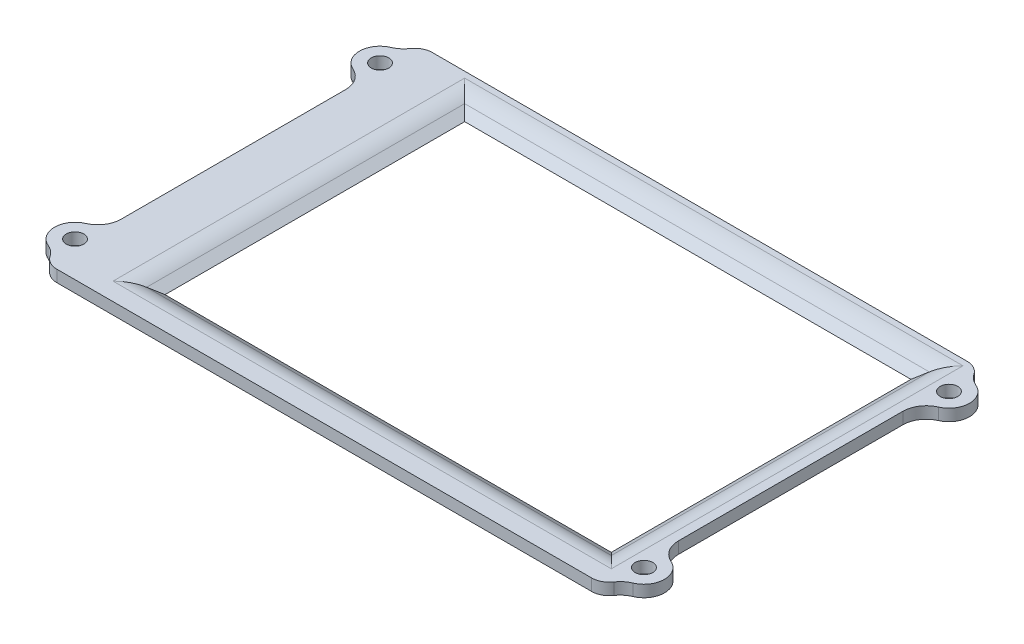
from build123d import *

# Parameters (mm, degrees)
SKETCH1_W           = 95
SKETCH1_H           = 64
BOSS_EXTRUDE1_DEPTH = 2
SKETCH2_R           = 3.5
BOSS_EXTRUDE2_DEPTH = 2
FILLET1_R           = 4
FILLET2_R           = 3
SKETCH3_R           = 1.5
CUT_EXTRUDE1_DEPTH  = 62.090097397
SKETCH4_W           = 75.8
SKETCH4_H           = 50.8
CUT_EXTRUDE2_DEPTH  = 62.090097397
CHAMFER1_SIZE       = 3
CHAMFER1_SIZE_2     = 2.100622615
FILLET3_R           = 5


with BuildPart() as part:
    # Sketch1 → Boss-Extrude1 (new body)
    with BuildSketch(Plane(origin=(0, 0, 0), x_dir=(1, 0, 0), z_dir=(0, 1, 0))):
        Rectangle(SKETCH1_W, SKETCH1_H)
    extrude(amount=BOSS_EXTRUDE1_DEPTH)

    # Sketch2 → Boss-Extrude2 (add)
    with BuildSketch(Plane(origin=(0, 2, 0), x_dir=(1, 0, 0), z_dir=(0, 1, 0))):
        with Locations((-48.5, -26)):
            Circle(SKETCH2_R)
        with Locations((-48.5, 26)):
            Circle(SKETCH2_R)
        with Locations((48.5, -26)):
            Circle(SKETCH2_R)
        with Locations((48.5, 26)):
            Circle(SKETCH2_R)
    extrude(amount=-BOSS_EXTRUDE2_DEPTH)

    # Fillet1
    # the kernel refuses this fillet: 4 mm, written as the material it adds along each edge
    with BuildSketch(Plane(origin=(-47.5, 0, -29.354101966), x_dir=(0, 0, -1), z_dir=(0, 1, 0))) as fillet1_piece_1:
        with BuildLine():
            CenterArc((3.565539249, 3.892847292), FILLET1_R, 202.68800958, 54.020199403)
            Line((-0.124936066, 2.349995403), (-0.198745572, 2.319138365))
            ThreePointArc((-0.198745572, 2.319138365), (0.061075022, 1.181565792), (-0.076665188, 0.022857143))
            Line((-0.076665188, 0.022857143), (0, -0.08))
            ThreePointArc((0, -0.08), (1.322949017, -0.08), (2.627505209, -0.077856946))
            Line((2.627505209, -0.077856946), (2.645898034, 0))
        make_face()
    extrude(amount=2)
    with BuildSketch(Plane(origin=(-47.5, 0, -22.645898034), x_dir=(-0.998147228603926, 0, -0.06084496717315217), z_dir=(0, 1, 0)), Plane(origin=(47.5, 0, 22.645898034), x_dir=(0.9981472286039255, 0, 0.06084496717316137), z_dir=(0, 1, 0))) as fillet1_piece_2:
        with BuildLine():
            CenterArc((3.778429137, 3.756620131), FILLET1_R, 183.48831444, 66.421821522)
            Line((-0.214159778, 3.513240263), (-0.294011556, 3.508372665))
            Line((-0.294011556, 3.508372665), (-0.079851778, -0.004867597))
            Line((-0.079851778, -0.004867597), (0.027479485, -0.075132403))
            ThreePointArc((0.027479485, -0.075132403), (1.202227453, 0.132957385), (2.376975421, -0.075132403))
            Line((2.376975421, -0.075132403), (2.404454905, 0))
        make_face()
    extrude(amount=2)
    with BuildSketch(Plane(origin=(-47.5, 0, 22.645898034), x_dir=(0, 0, -1), z_dir=(0, 1, 0)), Plane(origin=(47.5, 0, -22.645898034), x_dir=(0, 0, 1), z_dir=(0, 1, 0))) as fillet1_piece_3:
        with BuildLine():
            CenterArc((3.519761576, 4), FILLET1_R, 203.578178478, 66.421821522)
            Line((-0.14629898, 2.4), (-0.219620191, 2.368))
            ThreePointArc((-0.219620191, 2.368), (0.059561556, 1.208089788), (-0.076665188, 0.022857143))
            Line((-0.076665188, 0.022857143), (0, -0.08))
            Line((0, -0.08), (3.519761576, -0.08))
            Line((3.519761576, -0.08), (3.519761576, 0))
        make_face()
    extrude(amount=2)
    with BuildSketch(Plane(origin=(-47.5, 0, 29.354101966), x_dir=(-0.9985897627331907, 0, -0.05308941292263453), z_dir=(0, 1, 0)), Plane(origin=(47.5, 0, -29.354101966), x_dir=(0.9985897627331903, 0, 0.053089412922639356), z_dir=(0, 1, 0))) as fillet1_piece_4:
        with BuildLine():
            CenterArc((3.698065068, 3.76717997), FILLET1_R, 196.335021008, 54.020199403)
            Line((-0.140469173, 2.64216669), (-0.217239858, 2.619666424))
            ThreePointArc((-0.217239858, 2.619666424), (-0.150121768, 1.316836192), (-0.079887181, -0.004247153))
            Line((-0.079887181, -0.004247153), (0.026895019, -0.075343599))
            ThreePointArc((0.026895019, -0.075343599), (1.176657067, 0.123717526), (2.326419115, -0.075343599))
            Line((2.326419115, -0.075343599), (2.353314134, 0))
        make_face()
    extrude(amount=2)
    with BuildSketch(Plane(origin=(47.5, 0, 29.354101966), x_dir=(0.9985897627331901, 0, -0.05308941292264221), z_dir=(0, 1, 0))) as fillet1_piece_5:
        with BuildLine():
            CenterArc((3.698065068, -3.76717997), FILLET1_R, 109.64477959, 54.020199403)
            Line((-0.140469173, -2.64216669), (-0.217239858, -2.619666424))
            ThreePointArc((-0.217239858, -2.619666424), (-0.150121768, -1.316836192), (-0.079887181, 0.004247153))
            Line((-0.079887181, 0.004247153), (0.026895019, 0.075343599))
            ThreePointArc((0.026895019, 0.075343599), (1.176657067, -0.123717526), (2.326419115, 0.075343599))
            Line((2.326419115, 0.075343599), (2.353314134, 0))
        make_face()
    extrude(amount=2)

    # Fillet2
    fillet2_edges = [part.edges().sort_by_distance(p)[0] for p in [
        (-47.5, 1, -32),
        (47.5, 1, -32),
        (47.5, 1, 32),
        (-47.5, 1, 32),
    ]]
    fillet(fillet2_edges, radius=FILLET2_R)

    # Sketch3 → Cut-Extrude1 (cut, through all)
    with BuildSketch(Plane(origin=(0, 2, 0), x_dir=(1, 0, 0), z_dir=(0, 1, 0))):
        with Locations(Location((48.5, -26, 0), (0, 0, 270))):
            Circle(SKETCH3_R)
        with Locations(Location((48.5, 26, 0), (0, 0, 270))):
            Circle(SKETCH3_R)
        with Locations(Location((-48.5, 26, 0), (0, 0, 270))):
            Circle(SKETCH3_R)
        with Locations(Location((-48.5, -26, 0), (0, 0, 270))):
            Circle(SKETCH3_R)
    extrude(amount=-CUT_EXTRUDE1_DEPTH, mode=Mode.SUBTRACT)

    # Sketch4 → Cut-Extrude2 (cut, through all)
    with BuildSketch(Plane(origin=(0, 2, 0), x_dir=(1, 0, 0), z_dir=(0, 1, 0))):
        with Locations((3.429138832, 1.001657313)):
            Rectangle(SKETCH4_W, SKETCH4_H)
    extrude(amount=-CUT_EXTRUDE2_DEPTH, mode=Mode.SUBTRACT)

    # Chamfer1
    # the kernel refuses this chamfer: 3, 2.100622615 mm, written as the material it takes off along each edge
    with BuildSketch(Plane(origin=(-34.470861168, 2, -26.401657313), x_dir=(-0.9997533347641299, 0.022209674198456996, 0), z_dir=(0, 0, 1)), Plane(origin=(41.329138832, 2, 24.398342687), x_dir=(0.9997533347641299, 0.022209674198456996, 0), z_dir=(0, 0, -1))) as chamfer1_piece_1:
        Polygon((CHAMFER1_SIZE * 0.999753334764, CHAMFER1_SIZE * 0.0222096741985), (-CHAMFER1_SIZE_2 * 0.0222096741945, CHAMFER1_SIZE_2 * 0.999753334588), (0, 0), align=None)
    extrude(amount=50.8, mode=Mode.SUBTRACT)
    with BuildSketch(Plane(origin=(-34.470861168, 2, 24.398342687), x_dir=(0, 0.022209674198456996, 0.9997533347641299), z_dir=(1, 0, 0)), Plane(origin=(41.329138832, 2, -26.401657313), x_dir=(0, 0.022209674198456972, -0.99975333476413), z_dir=(-1, 0, 0))) as chamfer1_piece_2:
        Polygon((CHAMFER1_SIZE * 0.999753334764, CHAMFER1_SIZE * 0.0222096741985), (-CHAMFER1_SIZE_2 * 0.0222096741945, CHAMFER1_SIZE_2 * 0.999753334588), (0, 0), align=None)
    extrude(amount=75.8, mode=Mode.SUBTRACT)
    with BuildSketch(Plane(origin=(-34.470861168, 2, -34.149314004), x_dir=(-0.9997533347641299, 0.022209674198456996, 0), z_dir=(0, 0, 1))) as chamfer1_piece_3a_section:
        Polygon((CHAMFER1_SIZE * 0.999753334764, CHAMFER1_SIZE * 0.0222096741985), (-CHAMFER1_SIZE_2 * 0.0222096741945, CHAMFER1_SIZE_2 * 0.999753334588), (0, 0), align=None)
    chamfer1_piece_3a = extrude(amount=58.547656691, mode=Mode.PRIVATE)
    chamfer1_piece_3a = split(chamfer1_piece_3a, bisect_by=Plane(origin=(-35.470351342, 1.318269678, -26.401657313), z_dir=(0, 0, -1)), keep=Keep.TOP, mode=Mode.PRIVATE)
    with BuildSketch(Plane(origin=(41.329138832, 2, -26.401657313), x_dir=(0, 0.022209674198456972, -0.99975333476413), z_dir=(-1, 0, 0))) as chamfer1_piece_3b_section:
        Polygon((CHAMFER1_SIZE * 0.999753334764, CHAMFER1_SIZE * 0.0222096741985), (-CHAMFER1_SIZE_2 * 0.0222096741945, CHAMFER1_SIZE_2 * 0.999753334588), (0, 0), align=None)
    chamfer1_piece_3b = extrude(amount=83.547656691, mode=Mode.PRIVATE)
    chamfer1_piece_3b = split(chamfer1_piece_3b, bisect_by=Plane(origin=(-34.470861168, 1.318269678, -27.401147488), z_dir=(-1, 0, 0)), keep=Keep.TOP, mode=Mode.PRIVATE)
    chamfer1_piece_3 = chamfer1_piece_3a & chamfer1_piece_3b
    add(chamfer1_piece_3, mode=Mode.SUBTRACT)
    with BuildSketch(Plane(origin=(-34.470861168, 2, -26.401657313), x_dir=(-0.9997533347641299, 0.022209674198456996, 0), z_dir=(0, 0, 1))) as chamfer1_piece_4a_section:
        Polygon((CHAMFER1_SIZE * 0.999753334764, CHAMFER1_SIZE * 0.0222096741985), (-CHAMFER1_SIZE_2 * 0.0222096741945, CHAMFER1_SIZE_2 * 0.999753334588), (0, 0), align=None)
    chamfer1_piece_4a = extrude(amount=58.547656691, mode=Mode.PRIVATE)
    chamfer1_piece_4a = split(chamfer1_piece_4a, bisect_by=Plane(origin=(-35.470351342, 1.318269678, 24.398342687), z_dir=(0, 0, 1)), keep=Keep.TOP, mode=Mode.PRIVATE)
    with BuildSketch(Plane(origin=(-42.218517859, 2, 24.398342687), x_dir=(0, 0.022209674198456996, 0.9997533347641299), z_dir=(1, 0, 0))) as chamfer1_piece_4b_section:
        Polygon((CHAMFER1_SIZE * 0.999753334764, CHAMFER1_SIZE * 0.0222096741985), (-CHAMFER1_SIZE_2 * 0.0222096741945, CHAMFER1_SIZE_2 * 0.999753334588), (0, 0), align=None)
    chamfer1_piece_4b = extrude(amount=83.547656691, mode=Mode.PRIVATE)
    chamfer1_piece_4b = split(chamfer1_piece_4b, bisect_by=Plane(origin=(-34.470861168, 1.318269678, 25.397832861), z_dir=(-1, 0, 0)), keep=Keep.TOP, mode=Mode.PRIVATE)
    chamfer1_piece_4 = chamfer1_piece_4a & chamfer1_piece_4b
    add(chamfer1_piece_4, mode=Mode.SUBTRACT)
    with BuildSketch(Plane(origin=(41.329138832, 2, 32.145999377), x_dir=(0.9997533347641299, 0.022209674198456996, 0), z_dir=(0, 0, -1))) as chamfer1_piece_5a_section:
        Polygon((CHAMFER1_SIZE * 0.999753334764, CHAMFER1_SIZE * 0.0222096741985), (-CHAMFER1_SIZE_2 * 0.0222096741945, CHAMFER1_SIZE_2 * 0.999753334588), (0, 0), align=None)
    chamfer1_piece_5a = extrude(amount=58.547656691, mode=Mode.PRIVATE)
    chamfer1_piece_5a = split(chamfer1_piece_5a, bisect_by=Plane(origin=(42.328629006, 1.318269678, 24.398342687), z_dir=(0, 0, 1)), keep=Keep.TOP, mode=Mode.PRIVATE)
    with BuildSketch(Plane(origin=(-34.470861168, 2, 24.398342687), x_dir=(0, 0.022209674198456996, 0.9997533347641299), z_dir=(1, 0, 0))) as chamfer1_piece_5b_section:
        Polygon((CHAMFER1_SIZE * 0.999753334764, CHAMFER1_SIZE * 0.0222096741985), (-CHAMFER1_SIZE_2 * 0.0222096741945, CHAMFER1_SIZE_2 * 0.999753334588), (0, 0), align=None)
    chamfer1_piece_5b = extrude(amount=83.547656691, mode=Mode.PRIVATE)
    chamfer1_piece_5b = split(chamfer1_piece_5b, bisect_by=Plane(origin=(41.329138832, 1.318269678, 25.397832861), z_dir=(1, 0, 0)), keep=Keep.TOP, mode=Mode.PRIVATE)
    chamfer1_piece_5 = chamfer1_piece_5a & chamfer1_piece_5b
    add(chamfer1_piece_5, mode=Mode.SUBTRACT)
    with BuildSketch(Plane(origin=(49.076795523, 2, -26.401657313), x_dir=(0, 0.022209674198456944, -0.9997533347641299), z_dir=(-1, 0, 0))) as chamfer1_piece_6a_section:
        Polygon((CHAMFER1_SIZE * 0.999753334764, CHAMFER1_SIZE * 0.0222096741985), (-CHAMFER1_SIZE_2 * 0.0222096741945, CHAMFER1_SIZE_2 * 0.999753334588), (0, 0), align=None)
    chamfer1_piece_6a = extrude(amount=83.547656691, mode=Mode.PRIVATE)
    chamfer1_piece_6a = split(chamfer1_piece_6a, bisect_by=Plane(origin=(41.329138832, 1.318269678, -27.401147488), z_dir=(1, 0, 0)), keep=Keep.TOP, mode=Mode.PRIVATE)
    with BuildSketch(Plane(origin=(41.329138832, 2, 24.398342687), x_dir=(0.9997533347641299, 0.022209674198456996, 0), z_dir=(0, 0, -1))) as chamfer1_piece_6b_section:
        Polygon((CHAMFER1_SIZE * 0.999753334764, CHAMFER1_SIZE * 0.0222096741985), (-CHAMFER1_SIZE_2 * 0.0222096741945, CHAMFER1_SIZE_2 * 0.999753334588), (0, 0), align=None)
    chamfer1_piece_6b = extrude(amount=58.547656691, mode=Mode.PRIVATE)
    chamfer1_piece_6b = split(chamfer1_piece_6b, bisect_by=Plane(origin=(42.328629006, 1.318269678, -26.401657313), z_dir=(0, 0, -1)), keep=Keep.TOP, mode=Mode.PRIVATE)
    chamfer1_piece_6 = chamfer1_piece_6a & chamfer1_piece_6b
    add(chamfer1_piece_6, mode=Mode.SUBTRACT)

    # Fillet3
    fillet3_edges = [part.edges().sort_by_distance(p)[0] for p in [
        (3.429138832, 2, 27.398342687),
        (44.329138832, 2, -1.001657313),
        (3.429138832, 2, -29.401657313),
        (-37.470861168, 2, -1.001657313),
    ]]
    fillet(fillet3_edges, radius=FILLET3_R)


solid = part.part
